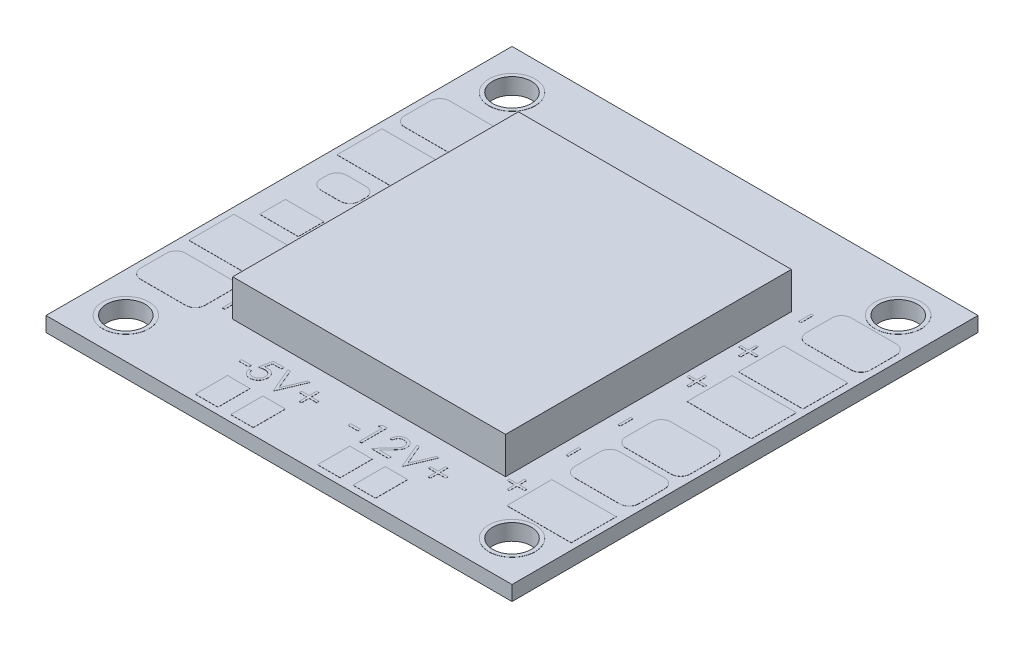
from build123d import *

# Parameters (mm, degrees)
SKETCH1_W                = 36.2
SKETCH1_H                = 36.2
SKETCH1_R                = 1.5
BOSS_EXTRUDE1_DEPTH      = 1.15
BOSS_EXTRUDE2_DEPTH      = 0.1
BOSS_EXTRUDE2_DEPTH_BACK = 1.25
SKETCH2_R                = 1.8
SKETCH2_R_2              = 1.5
SKETCH3_W                = 5
SKETCH3_H                = 3.5
SKETCH3_W_2              = 3
SKETCH3_H_2              = 2
BOSS_EXTRUDE3_DEPTH      = 0.1
FILLET1_R                = 0.75
SKETCH4_W                = 5
SKETCH4_H                = 3.5
BOSS_EXTRUDE4_DEPTH      = 0.1
FILLET2_R                = 0.75
SKETCH6_W                = 1.75
SKETCH6_H                = 2.5
SKETCH6_W_2              = 0.769230769
SKETCH6_H_2              = 0.205128205
SKETCH6_H_3              = 0.205128206
BOSS_EXTRUDE5_DEPTH      = 0.1
SKETCH7_W                = 21.2
SKETCH7_H                = 22.2
BOSS_EXTRUDE6_DEPTH      = 2.85
SKETCH8_W                = 0.17948718
SKETCH8_H                = 0.984438029
SKETCH8_W_2              = 0.179487179
SKETCH8_H_2              = 0.984438028
BOSS_EXTRUDE7_DEPTH      = 0.1
MOVE_START               = 1.16
MOVE_FACE1_OUTLINE_R     = 1.8
MOVE_FACE1_OUTLINE_W     = 5
MOVE_FACE1_OUTLINE_H     = 3.5
MOVE_FACE1_OUTLINE_W_2   = 3
MOVE_FACE1_OUTLINE_H_2   = 2
MOVE_FACE1_OUTLINE_W_3   = 1.75
MOVE_FACE1_OUTLINE_H_3   = 2.5
MOVE_FACE1_OUTLINE_W_4   = 0.769230769
MOVE_FACE1_OUTLINE_H_4   = 0.205128205
MOVE_FACE1_OUTLINE_H_5   = 0.205128206
MOVE_FACE1_OUTLINE_W_5   = 0.179487179
MOVE_FACE1_OUTLINE_H_6   = 0.984438028
MOVE_FACE1_OUTLINE_W_6   = 0.17948718
MOVE_FACE1_OUTLINE_H_7   = 0.984438029
MOVE_FACE1_DEPTH         = 0.09


# Read off the part's stored shape, not the designer's step: Move Face1
with BuildPart() as part:
    # Sketch1 → Boss-Extrude1 (new body)
    with BuildSketch(Plane(origin=(0, 0, 0), x_dir=(1, 0, 0), z_dir=(0, 1, 0))):
        with Locations((18.1, 18.1)):
            Rectangle(SKETCH1_W, SKETCH1_H)
        with Locations(Location((33.1, 33.1, 0), (0, 0, 270))):
            Circle(SKETCH1_R, mode=Mode.SUBTRACT)
        with Locations(Location((33.1, 3.1, 0), (0, 0, 270))):
            Circle(SKETCH1_R, mode=Mode.SUBTRACT)
        with Locations(Location((3.1, 3.1, 0), (0, 0, 270))):
            Circle(SKETCH1_R, mode=Mode.SUBTRACT)
        with Locations(Location((3.1, 33.1, 0), (0, 0, 270))):
            Circle(SKETCH1_R, mode=Mode.SUBTRACT)
    extrude(amount=BOSS_EXTRUDE1_DEPTH)

    # Sketch2 → Boss-Extrude2 (add, two sides: drawn at the far end of the back side and taken through both)
    # profile 1 of 4: a face of its own
    with BuildSketch(Plane(origin=(0, 1.15, 0), x_dir=(1, 0, 0), z_dir=(0, 1, 0)).offset(-BOSS_EXTRUDE2_DEPTH_BACK)):
        with Locations(Location((3.1, 33.1, 0), (0, 0, 270))):
            Circle(SKETCH2_R)
        with Locations(Location((3.1, 33.1, 0), (0, 0, 270))):
            Circle(SKETCH2_R_2, mode=Mode.SUBTRACT)
    # profile 2 of 4: a face of its own
    with BuildSketch(Plane(origin=(0, 1.15, 0), x_dir=(1, 0, 0), z_dir=(0, 1, 0)).offset(-BOSS_EXTRUDE2_DEPTH_BACK)):
        with Locations(Location((33.1, 33.1, 0), (0, 0, 270))):
            Circle(SKETCH2_R)
        with Locations(Location((33.1, 33.1, 0), (0, 0, 270))):
            Circle(SKETCH2_R_2, mode=Mode.SUBTRACT)
    # profile 3 of 4: a face of its own
    with BuildSketch(Plane(origin=(0, 1.15, 0), x_dir=(1, 0, 0), z_dir=(0, 1, 0)).offset(-BOSS_EXTRUDE2_DEPTH_BACK)):
        with Locations(Location((33.1, 3.1, 0), (0, 0, 270))):
            Circle(SKETCH2_R)
        with Locations(Location((33.1, 3.1, 0), (0, 0, 270))):
            Circle(SKETCH2_R_2, mode=Mode.SUBTRACT)
    # profile 4 of 4: a face of its own
    with BuildSketch(Plane(origin=(0, 1.15, 0), x_dir=(1, 0, 0), z_dir=(0, 1, 0)).offset(-BOSS_EXTRUDE2_DEPTH_BACK)):
        with Locations(Location((3.1, 3.1, 0), (0, 0, 270))):
            Circle(SKETCH2_R)
        with Locations(Location((3.1, 3.1, 0), (0, 0, 270))):
            Circle(SKETCH2_R_2, mode=Mode.SUBTRACT)
    extrude(amount=BOSS_EXTRUDE2_DEPTH + BOSS_EXTRUDE2_DEPTH_BACK)

    # Sketch3 → Boss-Extrude3 (add)
    with BuildSketch(Plane(origin=(0, 1.15, 0), x_dir=(1, 0, 0), z_dir=(0, 1, 0))):
        with Locations((3, 12.35)):
            Rectangle(SKETCH3_W, SKETCH3_H)
        with Locations((3, 7.85)):
            Rectangle(SKETCH3_W, SKETCH3_H)
        with Locations((3, 16.1)):
            Rectangle(SKETCH3_W_2, SKETCH3_H_2)
        with Locations((3, 20.1)):
            Rectangle(SKETCH3_W_2, SKETCH3_H_2)
        with Locations((3, 23.85)):
            Rectangle(SKETCH3_W, SKETCH3_H)
        with Locations((3, 28.35)):
            Rectangle(SKETCH3_W, SKETCH3_H)
    extrude(amount=BOSS_EXTRUDE3_DEPTH)

    # Fillet1
    fillet1_edges = [part.edges().sort_by_distance(p)[0] for p in [
        (4.5, 1.2, -19.1),
        (4.5, 1.2, -21.1),
        (1.5, 1.2, -21.1),
        (1.5, 1.2, -19.1),
        (0.5, 1.2, -30.1),
        (0.5, 1.2, -26.6),
        (5.5, 1.2, -26.6),
        (5.5, 1.2, -30.1),
        (5.5, 1.2, -9.6),
        (0.5, 1.2, -9.6),
        (0.5, 1.2, -6.1),
        (5.5, 1.2, -6.1),
    ]]
    fillet(fillet1_edges, radius=FILLET1_R)

    # Sketch4 → Boss-Extrude4 (add)
    with BuildSketch(Plane(origin=(0, 1.15, 0), x_dir=(1, 0, 0), z_dir=(0, 1, 0))):
        with Locations((33.2, 6.85)):
            Rectangle(SKETCH4_W, SKETCH4_H)
        with Locations((33.2, 11.35)):
            Rectangle(SKETCH4_W, SKETCH4_H)
        with Locations((33.2, 15.35)):
            Rectangle(SKETCH4_W, SKETCH4_H)
        with Locations((33.2, 20.85)):
            Rectangle(SKETCH4_W, SKETCH4_H)
        with Locations((33.2, 24.85)):
            Rectangle(SKETCH4_W, SKETCH4_H)
        with Locations((33.2, 29.35)):
            Rectangle(SKETCH4_W, SKETCH4_H)
    extrude(amount=BOSS_EXTRUDE4_DEPTH)

    # Fillet2
    fillet2_edges = [part.edges().sort_by_distance(p)[0] for p in [
        (30.7, 1.2, -13.1),
        (30.7, 1.2, -9.6),
        (35.7, 1.2, -9.6),
        (35.7, 1.2, -13.1),
        (35.7, 1.2, -17.1),
        (30.7, 1.2, -17.1),
        (30.7, 1.2, -13.6),
        (35.7, 1.2, -13.6),
        (35.7, 1.2, -31.1),
        (30.7, 1.2, -31.1),
        (30.7, 1.2, -27.6),
        (35.7, 1.2, -27.6),
    ]]
    fillet(fillet2_edges, radius=FILLET2_R)

    # Sketch6 → Boss-Extrude5 (add)
    with BuildSketch(Plane(origin=(0, 1.15, 0), x_dir=(1, 0, 0), z_dir=(0, 1, 0))):
        with Locations((14.725, 1.75)):
            Rectangle(SKETCH6_W, SKETCH6_H)
        with Locations((11.975, 1.75)):
            Rectangle(SKETCH6_W, SKETCH6_H)
        with Locations((21.475, 1.75)):
            Rectangle(SKETCH6_W, SKETCH6_H)
        with Locations((24.225, 1.75)):
            Rectangle(SKETCH6_W, SKETCH6_H)
        Polygon((25.116591699, 4.749584686), (25.706335289, 4.749584686), (25.706335289, 5.339328276), (25.885822468, 5.339328276), (25.885822468, 4.749584686), (26.475566058, 4.749584686), (26.475566058, 4.570097507), (25.885822468, 4.570097507), (25.885822468, 3.980353917), (25.706335289, 3.980353917), (25.706335289, 4.570097507), (25.116591699, 4.570097507), align=None)
        Polygon((23.988386571, 3.672661609), (23.142232725, 5.672661609), (23.334540417, 5.672661609), (24.001207083, 4.096539814), (24.66787375, 5.672661609), (24.860181442, 5.672661609), (24.014027596, 3.672661609), align=None)
        with BuildLine():
            add(Edge.make_bspline(
                [(22.298082083, 5.518815455), (22.267403513, 5.518541426), (22.221911666, 5.51547508), (22.163608709, 5.502300234), (22.122556889, 5.489066435), (22.083402658, 5.472230352), (22.046337537, 5.451264342), (22.011444449, 5.426245012), (21.97865785, 5.397879034), (21.94844993, 5.366297527), (21.921908598, 5.331091861), (21.898718729, 5.292904679), (21.878481032, 5.251839555), (21.862064308, 5.207521802), (21.844846661, 5.142825568), (21.837018135, 5.092084197), (21.834540417, 5.057276994)],
                knots=[0, 0, 0, 0, 0.126546911, 0.186887153, 0.245877536, 0.304040885, 0.362191218, 0.420975933, 0.480660283, 0.540600275, 0.600689098, 0.66193579, 0.724442506, 0.789038394, 0.856313757, 1, 1, 1, 1], degree=3))
            Line((21.834540417, 5.057276994), (21.655053237, 5.057276994))
            add(Edge.make_bspline(
                [(21.655053237, 5.057276994), (21.656188918, 5.104079344), (21.663698549, 5.172826753), (21.684691693, 5.261213654), (21.706436334, 5.322854291), (21.733474214, 5.381504858), (21.765889848, 5.436933488), (21.804286744, 5.488928432), (21.847833339, 5.537007805), (21.895129729, 5.581114876), (21.946161704, 5.619203988), (21.999787372, 5.651384058), (22.055844407, 5.678293014), (22.114963839, 5.698466833), (22.19833106, 5.71883383), (22.263434243, 5.724027812), (22.307296827, 5.723943661)],
                knots=[0, 0, 0, 0, 0.135103289, 0.198978674, 0.2619043, 0.323494969, 0.385195378, 0.446969239, 0.509764777, 0.572250569, 0.633405176, 0.693251163, 0.752583163, 0.812579266, 0.873275085, 1, 1, 1, 1], degree=3))
            add(Edge.make_bspline(
                [(22.307296827, 5.723943661), (22.350373881, 5.724014796), (22.413808172, 5.718698363), (22.495085012, 5.700173097), (22.551820594, 5.681155865), (22.60496699, 5.6555595), (22.654922997, 5.624819447), (22.702283461, 5.589264879), (22.744915927, 5.547405659), (22.784063327, 5.502718561), (22.817836311, 5.455011169), (22.846757152, 5.405737383), (22.870867935, 5.354520927), (22.888601065, 5.300881616), (22.906832764, 5.226343072), (22.910960033, 5.168246206), (22.911463494, 5.129392379)],
                knots=[0, 0, 0, 0, 0.136516798, 0.200788824, 0.263829673, 0.325735023, 0.387290692, 0.449509219, 0.51296782, 0.576275215, 0.6375801, 0.697902606, 0.757172088, 0.816598528, 0.876653171, 1, 1, 1, 1], degree=3))
            add(Edge.make_bspline(
                [(22.911463494, 5.129392379), (22.91169315, 5.074154969), (22.901000515, 4.991679583), (22.866506285, 4.886537579), (22.835692252, 4.823258841), (22.804559095, 4.772268314), (22.776510539, 4.730286189), (22.743673072, 4.685083057), (22.705571123, 4.636810337), (22.662992679, 4.585089624), (22.597242096, 4.508676856), (22.54373959, 4.451459909), (22.506816058, 4.411844302)],
                knots=[0, 0, 0, 0, 0.195672309, 0.292422427, 0.391342544, 0.444462441, 0.504228775, 0.570352338, 0.642545753, 0.722287505, 0.807921123, 1, 1, 1, 1], degree=3))
            Line((22.506816058, 4.411844302), (22.006415417, 3.877789814))
            Line((22.006415417, 3.877789814), (22.937104519, 3.877789814))
            Line((22.937104519, 3.877789814), (22.937104519, 3.672661609))
            Line((22.937104519, 3.672661609), (21.57813016, 3.672661609))
            Line((21.57813016, 3.672661609), (22.353771186, 4.500385968))
            add(Edge.make_bspline(
                [(22.353771186, 4.500385968), (22.390136497, 4.538157854), (22.441995618, 4.592932834), (22.506311591, 4.66453281), (22.547465803, 4.711723733), (22.58279878, 4.755513516), (22.614154849, 4.794481855), (22.639276691, 4.830341531), (22.666547904, 4.871907692), (22.692921286, 4.922656933), (22.723264396, 5.005091021), (22.732009138, 5.070254844), (22.731976314, 5.113366737)],
                knots=[0, 0, 0, 0, 0.212829202, 0.30610131, 0.390647321, 0.466924469, 0.534481039, 0.593586941, 0.644557005, 0.736200453, 0.825024026, 1, 1, 1, 1], degree=3))
            add(Edge.make_bspline(
                [(22.731976314, 5.113366737), (22.732119273, 5.14027045), (22.727976173, 5.180096684), (22.715016061, 5.231376665), (22.701350207, 5.268136057), (22.683284537, 5.303247808), (22.661301018, 5.336754954), (22.635934914, 5.36914864), (22.606591431, 5.399521973), (22.574356251, 5.427339736), (22.540302398, 5.45198232), (22.504273777, 5.472575188), (22.466422233, 5.489460593), (22.426853568, 5.502690768), (22.370853515, 5.515180382), (22.3274636, 5.518703737), (22.298082083, 5.518815455)],
                knots=[0, 0, 0, 0, 0.122121906, 0.180988497, 0.239933216, 0.299905831, 0.359988847, 0.421775742, 0.486575826, 0.551534805, 0.615017543, 0.677258617, 0.739729962, 0.803050103, 0.866495132, 1, 1, 1, 1], degree=3))
        make_face()
        Polygon((20.34736093, 5.467533404), (20.46474875, 5.672661609), (20.834540417, 5.672661609), (20.834540417, 3.672661609), (20.655053237, 3.672661609), (20.655053237, 5.467533404), align=None)
        with Locations((19.501207083, 4.441892379)):
            Rectangle(SKETCH6_W_2, SKETCH6_H_2)
        with BuildLine():
            add(Edge.make_bspline(
                [(12.16370382, 4.843225023), (12.13168704, 4.843166845), (12.082409474, 4.839640055), (12.015499602, 4.829014911), (11.96160495, 4.817840087), (11.905252177, 4.803185163), (11.824797339, 4.779154032), (11.764108106, 4.756731126), (11.722998691, 4.740660921)],
                knots=[0, 0, 0, 0, 0.211023342, 0.325099662, 0.446502097, 0.573787718, 0.70890071, 1, 1, 1, 1], degree=3))
            Line((11.722998691, 4.740660921), (11.928126897, 5.740660921))
            Line((11.928126897, 5.740660921), (12.748639717, 5.740660921))
            Line((12.748639717, 5.740660921), (12.748639717, 5.535532716))
            Line((12.748639717, 5.535532716), (12.068351256, 5.535532716))
            Line((12.068351256, 5.535532716), (11.96057882, 5.009491049))
            add(Edge.make_bspline(
                [(11.96057882, 5.009491049), (12.001470777, 5.021085013), (12.079033852, 5.041068879), (12.158849901, 5.048213881), (12.196155743, 5.048353228)],
                knots=[0, 0, 0, 0, 0.53290146, 1, 1, 1, 1], degree=3))
            add(Edge.make_bspline(
                [(12.196155743, 5.048353228), (12.240054787, 5.04857831), (12.30489077, 5.042988399), (12.387986802, 5.023409257), (12.446273599, 5.003362686), (12.501622556, 4.977694125), (12.553524003, 4.945638583), (12.602757093, 4.908190537), (12.648438604, 4.865136363), (12.689880954, 4.817752549), (12.726319075, 4.766805207), (12.757267589, 4.71278938), (12.782165221, 4.655189102), (12.802019765, 4.594640746), (12.820098589, 4.507570467), (12.825768408, 4.44000911), (12.825562794, 4.394106434)],
                knots=[0, 0, 0, 0, 0.129394274, 0.190894061, 0.251281069, 0.310814964, 0.370370987, 0.430768263, 0.492881251, 0.555103948, 0.616067051, 0.677256033, 0.738259805, 0.800762134, 0.864777582, 1, 1, 1, 1], degree=3))
            add(Edge.make_bspline(
                [(12.825562794, 4.394106434), (12.825015114, 4.361760177), (12.823137624, 4.313467518), (12.813193468, 4.250284098), (12.803273229, 4.204231914), (12.790390744, 4.159277825), (12.774797292, 4.115294138), (12.755713768, 4.072554351), (12.734781575, 4.030654128), (12.711212154, 3.990540695), (12.685053008, 3.953026988), (12.657415584, 3.917550256), (12.62767765, 3.88449098), (12.595562795, 3.854066399), (12.561459957, 3.826095951), (12.525641261, 3.800106624), (12.487552551, 3.77715335), (12.448042559, 3.756031737), (12.406540727, 3.738703716), (12.363991731, 3.723213061), (12.319783326, 3.710860659), (12.274015065, 3.701200672), (12.210068062, 3.692252789), (12.161137296, 3.688861335), (12.128046768, 3.68937887)],
                knots=[0, 0, 0, 0, 0.087434124, 0.130118399, 0.172553695, 0.214554756, 0.256298092, 0.298438225, 0.340849003, 0.382715189, 0.423924045, 0.464246243, 0.504073671, 0.543861906, 0.583566725, 0.623094319, 0.663229061, 0.703551259, 0.743937895, 0.784541255, 0.825750111, 0.867757363, 0.910745164, 1, 1, 1, 1], degree=3))
            add(Edge.make_bspline(
                [(12.128046768, 3.68937887), (12.088806192, 3.688926707), (12.030980678, 3.69446311), (11.956207185, 3.710330321), (11.903560754, 3.727813188), (11.853063063, 3.749755011), (11.80539289, 3.777476865), (11.759332465, 3.808893952), (11.716754134, 3.845968312), (11.677236437, 3.886491603), (11.641860989, 3.930467349), (11.610357206, 3.977170039), (11.583222841, 4.026825562), (11.560097102, 4.079306859), (11.535415586, 4.154387222), (11.52324172, 4.213281975), (11.517870486, 4.253481434)],
                knots=[0, 0, 0, 0, 0.128708372, 0.190236142, 0.250724402, 0.310637179, 0.370766408, 0.431614744, 0.493522974, 0.555883455, 0.617342367, 0.678668039, 0.74071136, 0.802985363, 0.86680258, 1, 1, 1, 1], degree=3))
            Line((11.517870486, 4.253481434), (11.697357666, 4.253481434))
            add(Edge.make_bspline(
                [(11.697357666, 4.253481434), (11.705043092, 4.216729093), (11.720114672, 4.163799515), (11.751685397, 4.100352172), (11.778760221, 4.059453657), (11.811077998, 4.023791919), (11.847950983, 3.992010098), (11.889292909, 3.963340722), (11.935231421, 3.939433767), (11.983697581, 3.919082847), (12.051368072, 3.900819801), (12.103489987, 3.893996129), (12.138463435, 3.894507075)],
                knots=[0, 0, 0, 0, 0.181994156, 0.264376949, 0.342179862, 0.418617611, 0.496509075, 0.577369092, 0.661510592, 0.746732551, 0.831257984, 1, 1, 1, 1], degree=3))
            add(Edge.make_bspline(
                [(12.138463435, 3.894507075), (12.172180732, 3.894538756), (12.222185959, 3.899111511), (12.286789644, 3.91396868), (12.332496894, 3.930333878), (12.376817723, 3.950249823), (12.418631321, 3.975800017), (12.459147243, 4.005206093), (12.497106196, 4.038895499), (12.531871525, 4.076021061), (12.562589565, 4.115722437), (12.588175433, 4.158074865), (12.609741265, 4.202345451), (12.626101449, 4.249018108), (12.64199027, 4.315198608), (12.645816294, 4.366863813), (12.646075615, 4.401718613)],
                knots=[0, 0, 0, 0, 0.12642469, 0.187680284, 0.248216424, 0.30830506, 0.369660991, 0.431698552, 0.495946892, 0.559758024, 0.622295408, 0.683910635, 0.745092408, 0.806740225, 0.869086618, 1, 1, 1, 1], degree=3))
            add(Edge.make_bspline(
                [(12.646075615, 4.401718613), (12.645930038, 4.433073736), (12.642755831, 4.479482155), (12.62846982, 4.538577762), (12.613952884, 4.579785015), (12.595504556, 4.618770071), (12.572964578, 4.655571758), (12.545905284, 4.689705391), (12.51499569, 4.721186857), (12.48113394, 4.750241029), (12.443737506, 4.775009241), (12.403589028, 4.795845152), (12.36117191, 4.813829233), (12.315478478, 4.826734721), (12.249838982, 4.840024204), (12.198500111, 4.842958086), (12.16370382, 4.843225023)],
                knots=[0, 0, 0, 0, 0.127916032, 0.188360206, 0.247216077, 0.305630129, 0.36376984, 0.422660914, 0.482687294, 0.543300221, 0.604117955, 0.664964891, 0.727413494, 0.791467625, 0.858055443, 1, 1, 1, 1], degree=3))
        make_face()
        Polygon((15.030690999, 4.817583998), (15.620434589, 4.817583998), (15.620434589, 5.407327587), (15.799921768, 5.407327587), (15.799921768, 4.817583998), (16.389665358, 4.817583998), (16.389665358, 4.638096818), (15.799921768, 4.638096818), (15.799921768, 4.048353228), (15.620434589, 4.048353228), (15.620434589, 4.638096818), (15.030690999, 4.638096818), align=None)
        with Locations((10.953767923, 4.50989169)):
            Rectangle(SKETCH6_W_2, SKETCH6_H_3)
        Polygon((13.902485871, 3.740660921), (13.056332025, 5.740660921), (13.248639717, 5.740660921), (13.915306384, 4.164539126), (14.58197305, 5.740660921), (14.774280743, 5.740660921), (13.928126897, 3.740660921), align=None)
    extrude(amount=BOSS_EXTRUDE5_DEPTH)

    # Sketch7 → Boss-Extrude6 (add)
    with BuildSketch(Plane(origin=(0, 1.15, 0), x_dir=(1, 0, 0), z_dir=(0, 1, 0))):
        with Locations((18.1, 18.1)):
            Rectangle(SKETCH7_W, SKETCH7_H)
    extrude(amount=BOSS_EXTRUDE6_DEPTH)

    # Sketch8 → Boss-Extrude7 (add)
    with BuildSketch(Plane(origin=(0, 1.15, 0), x_dir=(1, 0, 0), z_dir=(0, 1, 0))):
        Polygon((6.413850207, 23.91623645), (6.413850207, 24.50598004), (6.593337386, 24.50598004), (6.593337386, 23.91623645), (7.183080976, 23.91623645), (7.183080976, 23.736749271), (6.593337386, 23.736749271), (6.593337386, 23.147005681), (6.413850207, 23.147005681), (6.413850207, 23.736749271), (5.824106617, 23.736749271), (5.824106617, 23.91623645), align=None)
        Polygon((6.408009777, 12.435432042), (6.408009777, 13.025175632), (6.587496956, 13.025175632), (6.587496956, 12.435432042), (7.177240546, 12.435432042), (7.177240546, 12.255944862), (6.587496956, 12.255944862), (6.587496956, 11.666201273), (6.408009777, 11.666201273), (6.408009777, 12.255944862), (5.818266187, 12.255944862), (5.818266187, 12.435432042), align=None)
        Polygon((6.38587471, 16.150918099), (6.38587471, 16.740661689), (6.56536189, 16.740661689), (6.56536189, 16.150918099), (7.155105479, 16.150918099), (7.155105479, 15.97143092), (6.56536189, 15.97143092), (6.56536189, 15.38168733), (6.38587471, 15.38168733), (6.38587471, 15.97143092), (5.79613112, 15.97143092), (5.79613112, 16.150918099), align=None)
        Polygon((29.610733191, 6.980624635), (29.610733191, 7.570368225), (29.790220371, 7.570368225), (29.790220371, 6.980624635), (30.379963961, 6.980624635), (30.379963961, 6.801137456), (29.790220371, 6.801137456), (29.790220371, 6.211393866), (29.610733191, 6.211393866), (29.610733191, 6.801137456), (29.020989602, 6.801137456), (29.020989602, 6.980624635), align=None)
        Polygon((29.613806009, 20.937785377), (29.613806009, 21.527528967), (29.793293189, 21.527528967), (29.793293189, 20.937785377), (30.383036779, 20.937785377), (30.383036779, 20.758298198), (29.793293189, 20.758298198), (29.793293189, 20.168554608), (29.613806009, 20.168554608), (29.613806009, 20.758298198), (29.02406242, 20.758298198), (29.02406242, 20.937785377), align=None)
        Polygon((29.603760052, 24.96079073), (29.603760052, 25.55053432), (29.783247232, 25.55053432), (29.783247232, 24.96079073), (30.372990822, 24.96079073), (30.372990822, 24.781303551), (29.783247232, 24.781303551), (29.783247232, 24.191559961), (29.603760052, 24.191559961), (29.603760052, 24.781303551), (29.014016463, 24.781303551), (29.014016463, 24.96079073), align=None)
        with Locations((6.436664338, 20.101629096)):
            Rectangle(SKETCH8_W, SKETCH8_H)
        with Locations((6.503593797, 28.305588638)):
            Rectangle(SKETCH8_W_2, SKETCH8_H_2)
        with Locations((6.438743943, 7.839661137)):
            Rectangle(SKETCH8_W, SKETCH8_H)
        with Locations((29.668077234, 15.351769276)):
            Rectangle(SKETCH8_W_2, SKETCH8_H)
        with Locations((29.670053735, 11.296604652)):
            Rectangle(SKETCH8_W_2, SKETCH8_H)
        with Locations((29.725419986, 29.319055313)):
            Rectangle(SKETCH8_W, SKETCH8_H)
    extrude(amount=BOSS_EXTRUDE7_DEPTH)

    # Move Face1 outline → Move Face1 (cut)
    with BuildSketch(Plane(origin=(0, 0, 0), x_dir=(1, 0, 0), z_dir=(0, 1, 0)).offset(MOVE_START)):
        with BuildLine():
            add(Edge.make_bspline(
                [(22.298082083, 5.518815455), (22.267403513, 5.518541426), (22.221911666, 5.51547508), (22.163608709, 5.502300234), (22.122556889, 5.489066435), (22.083402658, 5.472230352), (22.046337537, 5.451264342), (22.011444449, 5.426245012), (21.97865785, 5.397879034), (21.94844993, 5.366297527), (21.921908598, 5.331091861), (21.898718729, 5.292904679), (21.878481032, 5.251839555), (21.862064308, 5.207521802), (21.844846661, 5.142825568), (21.837018135, 5.092084197), (21.834540417, 5.057276994)],
                knots=[0, 0, 0, 0, 0.126546911, 0.186887153, 0.245877536, 0.304040885, 0.362191218, 0.420975933, 0.480660283, 0.540600275, 0.600689098, 0.66193579, 0.724442506, 0.789038394, 0.856313757, 1, 1, 1, 1], degree=3))
            add(Edge.make_bspline(
                [(22.731976314, 5.113366737), (22.732119273, 5.14027045), (22.727976173, 5.180096684), (22.715016061, 5.231376665), (22.701350207, 5.268136057), (22.683284537, 5.303247808), (22.661301018, 5.336754954), (22.635934914, 5.36914864), (22.606591431, 5.399521973), (22.574356251, 5.427339736), (22.540302398, 5.45198232), (22.504273777, 5.472575188), (22.466422233, 5.489460593), (22.426853568, 5.502690768), (22.370853515, 5.515180382), (22.3274636, 5.518703737), (22.298082083, 5.518815455)],
                knots=[0, 0, 0, 0, 0.122121906, 0.180988497, 0.239933216, 0.299905831, 0.359988847, 0.421775742, 0.486575826, 0.551534805, 0.615017543, 0.677258617, 0.739729962, 0.803050103, 0.866495132, 1, 1, 1, 1], degree=3))
            add(Edge.make_bspline(
                [(22.353771186, 4.500385968), (22.390136497, 4.538157854), (22.441995618, 4.592932834), (22.506311591, 4.66453281), (22.547465803, 4.711723733), (22.58279878, 4.755513516), (22.614154849, 4.794481855), (22.639276691, 4.830341531), (22.666547904, 4.871907692), (22.692921286, 4.922656933), (22.723264396, 5.005091021), (22.732009138, 5.070254844), (22.731976314, 5.113366737)],
                knots=[0, 0, 0, 0, 0.212829202, 0.30610131, 0.390647321, 0.466924469, 0.534481039, 0.593586941, 0.644557005, 0.736200453, 0.825024026, 1, 1, 1, 1], degree=3))
            Line((22.353771186, 4.500385968), (21.57813016, 3.672661609))
            Line((21.57813016, 3.672661609), (22.937104519, 3.672661609))
            Line((22.937104519, 3.672661609), (22.937104519, 3.877789814))
            Line((22.937104519, 3.877789814), (22.006415417, 3.877789814))
            Line((22.006415417, 3.877789814), (22.506816058, 4.411844302))
            add(Edge.make_bspline(
                [(22.911463494, 5.129392379), (22.91169315, 5.074154969), (22.901000515, 4.991679583), (22.866506285, 4.886537579), (22.835692252, 4.823258841), (22.804559095, 4.772268314), (22.776510539, 4.730286189), (22.743673072, 4.685083057), (22.705571123, 4.636810337), (22.662992679, 4.585089624), (22.597242096, 4.508676856), (22.54373959, 4.451459909), (22.506816058, 4.411844302)],
                knots=[0, 0, 0, 0, 0.195672309, 0.292422427, 0.391342544, 0.444462441, 0.504228775, 0.570352338, 0.642545753, 0.722287505, 0.807921123, 1, 1, 1, 1], degree=3))
            add(Edge.make_bspline(
                [(22.307296827, 5.723943661), (22.350373881, 5.724014796), (22.413808172, 5.718698363), (22.495085012, 5.700173097), (22.551820594, 5.681155865), (22.60496699, 5.6555595), (22.654922997, 5.624819447), (22.702283461, 5.589264879), (22.744915927, 5.547405659), (22.784063327, 5.502718561), (22.817836311, 5.455011169), (22.846757152, 5.405737383), (22.870867935, 5.354520927), (22.888601065, 5.300881616), (22.906832764, 5.226343072), (22.910960033, 5.168246206), (22.911463494, 5.129392379)],
                knots=[0, 0, 0, 0, 0.136516798, 0.200788824, 0.263829673, 0.325735023, 0.387290692, 0.449509219, 0.51296782, 0.576275215, 0.6375801, 0.697902606, 0.757172088, 0.816598528, 0.876653171, 1, 1, 1, 1], degree=3))
            add(Edge.make_bspline(
                [(21.655053237, 5.057276994), (21.656188918, 5.104079344), (21.663698549, 5.172826753), (21.684691693, 5.261213654), (21.706436334, 5.322854291), (21.733474214, 5.381504858), (21.765889848, 5.436933488), (21.804286744, 5.488928432), (21.847833339, 5.537007805), (21.895129729, 5.581114876), (21.946161704, 5.619203988), (21.999787372, 5.651384058), (22.055844407, 5.678293014), (22.114963839, 5.698466833), (22.19833106, 5.71883383), (22.263434243, 5.724027812), (22.307296827, 5.723943661)],
                knots=[0, 0, 0, 0, 0.135103289, 0.198978674, 0.2619043, 0.323494969, 0.385195378, 0.446969239, 0.509764777, 0.572250569, 0.633405176, 0.693251163, 0.752583163, 0.812579266, 0.873275085, 1, 1, 1, 1], degree=3))
            Line((21.655053237, 5.057276994), (21.834540417, 5.057276994))
        make_face()
        with BuildLine():
            add(Edge.make_bspline(
                [(12.16370382, 4.843225023), (12.13168704, 4.843166845), (12.082409474, 4.839640055), (12.015499602, 4.829014911), (11.96160495, 4.817840087), (11.905252177, 4.803185163), (11.824797339, 4.779154032), (11.764108106, 4.756731126), (11.722998691, 4.740660921)],
                knots=[0, 0, 0, 0, 0.211023342, 0.325099662, 0.446502097, 0.573787718, 0.70890071, 1, 1, 1, 1], degree=3))
            add(Edge.make_bspline(
                [(12.646075615, 4.401718613), (12.645930038, 4.433073736), (12.642755831, 4.479482155), (12.62846982, 4.538577762), (12.613952884, 4.579785015), (12.595504556, 4.618770071), (12.572964578, 4.655571758), (12.545905284, 4.689705391), (12.51499569, 4.721186857), (12.48113394, 4.750241029), (12.443737506, 4.775009241), (12.403589028, 4.795845152), (12.36117191, 4.813829233), (12.315478478, 4.826734721), (12.249838982, 4.840024204), (12.198500111, 4.842958086), (12.16370382, 4.843225023)],
                knots=[0, 0, 0, 0, 0.127916032, 0.188360206, 0.247216077, 0.305630129, 0.36376984, 0.422660914, 0.482687294, 0.543300221, 0.604117955, 0.664964891, 0.727413494, 0.791467625, 0.858055443, 1, 1, 1, 1], degree=3))
            add(Edge.make_bspline(
                [(12.138463435, 3.894507075), (12.172180732, 3.894538756), (12.222185959, 3.899111511), (12.286789644, 3.91396868), (12.332496894, 3.930333878), (12.376817723, 3.950249823), (12.418631321, 3.975800017), (12.459147243, 4.005206093), (12.497106196, 4.038895499), (12.531871525, 4.076021061), (12.562589565, 4.115722437), (12.588175433, 4.158074865), (12.609741265, 4.202345451), (12.626101449, 4.249018108), (12.64199027, 4.315198608), (12.645816294, 4.366863813), (12.646075615, 4.401718613)],
                knots=[0, 0, 0, 0, 0.12642469, 0.187680284, 0.248216424, 0.30830506, 0.369660991, 0.431698552, 0.495946892, 0.559758024, 0.622295408, 0.683910635, 0.745092408, 0.806740225, 0.869086618, 1, 1, 1, 1], degree=3))
            add(Edge.make_bspline(
                [(11.697357666, 4.253481434), (11.705043092, 4.216729093), (11.720114672, 4.163799515), (11.751685397, 4.100352172), (11.778760221, 4.059453657), (11.811077998, 4.023791919), (11.847950983, 3.992010098), (11.889292909, 3.963340722), (11.935231421, 3.939433767), (11.983697581, 3.919082847), (12.051368072, 3.900819801), (12.103489987, 3.893996129), (12.138463435, 3.894507075)],
                knots=[0, 0, 0, 0, 0.181994156, 0.264376949, 0.342179862, 0.418617611, 0.496509075, 0.577369092, 0.661510592, 0.746732551, 0.831257984, 1, 1, 1, 1], degree=3))
            Line((11.697357666, 4.253481434), (11.517870486, 4.253481434))
            add(Edge.make_bspline(
                [(12.128046768, 3.68937887), (12.088806192, 3.688926707), (12.030980678, 3.69446311), (11.956207185, 3.710330321), (11.903560754, 3.727813188), (11.853063063, 3.749755011), (11.80539289, 3.777476865), (11.759332465, 3.808893952), (11.716754134, 3.845968312), (11.677236437, 3.886491603), (11.641860989, 3.930467349), (11.610357206, 3.977170039), (11.583222841, 4.026825562), (11.560097102, 4.079306859), (11.535415586, 4.154387222), (11.52324172, 4.213281975), (11.517870486, 4.253481434)],
                knots=[0, 0, 0, 0, 0.128708372, 0.190236142, 0.250724402, 0.310637179, 0.370766408, 0.431614744, 0.493522974, 0.555883455, 0.617342367, 0.678668039, 0.74071136, 0.802985363, 0.86680258, 1, 1, 1, 1], degree=3))
            add(Edge.make_bspline(
                [(12.825562794, 4.394106434), (12.825015114, 4.361760177), (12.823137624, 4.313467518), (12.813193468, 4.250284098), (12.803273229, 4.204231914), (12.790390744, 4.159277825), (12.774797292, 4.115294138), (12.755713768, 4.072554351), (12.734781575, 4.030654128), (12.711212154, 3.990540695), (12.685053008, 3.953026988), (12.657415584, 3.917550256), (12.62767765, 3.88449098), (12.595562795, 3.854066399), (12.561459957, 3.826095951), (12.525641261, 3.800106624), (12.487552551, 3.77715335), (12.448042559, 3.756031737), (12.406540727, 3.738703716), (12.363991731, 3.723213061), (12.319783326, 3.710860659), (12.274015065, 3.701200672), (12.210068062, 3.692252789), (12.161137296, 3.688861335), (12.128046768, 3.68937887)],
                knots=[0, 0, 0, 0, 0.087434124, 0.130118399, 0.172553695, 0.214554756, 0.256298092, 0.298438225, 0.340849003, 0.382715189, 0.423924045, 0.464246243, 0.504073671, 0.543861906, 0.583566725, 0.623094319, 0.663229061, 0.703551259, 0.743937895, 0.784541255, 0.825750111, 0.867757363, 0.910745164, 1, 1, 1, 1], degree=3))
            add(Edge.make_bspline(
                [(12.196155743, 5.048353228), (12.240054787, 5.04857831), (12.30489077, 5.042988399), (12.387986802, 5.023409257), (12.446273599, 5.003362686), (12.501622556, 4.977694125), (12.553524003, 4.945638583), (12.602757093, 4.908190537), (12.648438604, 4.865136363), (12.689880954, 4.817752549), (12.726319075, 4.766805207), (12.757267589, 4.71278938), (12.782165221, 4.655189102), (12.802019765, 4.594640746), (12.820098589, 4.507570467), (12.825768408, 4.44000911), (12.825562794, 4.394106434)],
                knots=[0, 0, 0, 0, 0.129394274, 0.190894061, 0.251281069, 0.310814964, 0.370370987, 0.430768263, 0.492881251, 0.555103948, 0.616067051, 0.677256033, 0.738259805, 0.800762134, 0.864777582, 1, 1, 1, 1], degree=3))
            add(Edge.make_bspline(
                [(11.96057882, 5.009491049), (12.001470777, 5.021085013), (12.079033852, 5.041068879), (12.158849901, 5.048213881), (12.196155743, 5.048353228)],
                knots=[0, 0, 0, 0, 0.53290146, 1, 1, 1, 1], degree=3))
            Line((11.96057882, 5.009491049), (12.068351256, 5.535532716))
            Line((12.068351256, 5.535532716), (12.748639717, 5.535532716))
            Line((12.748639717, 5.535532716), (12.748639717, 5.740660921))
            Line((12.748639717, 5.740660921), (11.928126897, 5.740660921))
            Line((11.928126897, 5.740660921), (11.722998691, 4.740660921))
        make_face()
        with Locations((3.1, 33.1)):
            Circle(MOVE_FACE1_OUTLINE_R)
        with Locations((33.1, 33.1)):
            Circle(MOVE_FACE1_OUTLINE_R)
        with Locations((33.1, 3.1)):
            Circle(MOVE_FACE1_OUTLINE_R)
        with Locations((3.1, 3.1)):
            Circle(MOVE_FACE1_OUTLINE_R)
        with Locations((3, 12.35)):
            Rectangle(MOVE_FACE1_OUTLINE_W, MOVE_FACE1_OUTLINE_H)
        with BuildLine():
            Line((0.5, 8.85), (0.5, 6.85))
            ThreePointArc((0.5, 6.85), (0.719669914, 6.319669914), (1.25, 6.1))
            Line((1.25, 6.1), (4.75, 6.1))
            ThreePointArc((4.75, 6.1), (5.280330086, 6.319669914), (5.5, 6.85))
            Line((5.5, 6.85), (5.5, 8.85))
            ThreePointArc((5.5, 8.85), (5.280330086, 9.380330086), (4.75, 9.6))
            Line((4.75, 9.6), (1.25, 9.6))
            ThreePointArc((1.25, 9.6), (0.719669914, 9.380330086), (0.5, 8.85))
        make_face()
        with Locations((3, 23.85)):
            Rectangle(MOVE_FACE1_OUTLINE_W, MOVE_FACE1_OUTLINE_H)
        with BuildLine():
            Line((0.5, 29.35), (0.5, 27.35))
            ThreePointArc((0.5, 27.35), (0.719669914, 26.819669914), (1.25, 26.6))
            Line((1.25, 26.6), (4.75, 26.6))
            ThreePointArc((4.75, 26.6), (5.280330086, 26.819669914), (5.5, 27.35))
            Line((5.5, 27.35), (5.5, 29.35))
            ThreePointArc((5.5, 29.35), (5.280330086, 29.880330086), (4.75, 30.1))
            Line((4.75, 30.1), (1.25, 30.1))
            ThreePointArc((1.25, 30.1), (0.719669914, 29.880330086), (0.5, 29.35))
        make_face()
        with Locations((3, 16.1)):
            Rectangle(MOVE_FACE1_OUTLINE_W_2, MOVE_FACE1_OUTLINE_H_2)
        with BuildLine():
            ThreePointArc((35.7, 16.35), (35.480330086, 16.880330086), (34.95, 17.1))
            Line((34.95, 17.1), (31.45, 17.1))
            ThreePointArc((31.45, 17.1), (30.919669914, 16.880330086), (30.7, 16.35))
            Line((30.7, 16.35), (30.7, 14.35))
            ThreePointArc((30.7, 14.35), (30.919669914, 13.819669914), (31.45, 13.6))
            Line((31.45, 13.6), (34.95, 13.6))
            ThreePointArc((34.95, 13.6), (35.480330086, 13.819669914), (35.7, 14.35))
            Line((35.7, 14.35), (35.7, 16.35))
        make_face()
        with BuildLine():
            Line((1.5, 20.35), (1.5, 19.85))
            ThreePointArc((1.5, 19.85), (1.719669914, 19.319669914), (2.25, 19.1))
            Line((2.25, 19.1), (3.75, 19.1))
            ThreePointArc((3.75, 19.1), (4.280330086, 19.319669914), (4.5, 19.85))
            Line((4.5, 19.85), (4.5, 20.35))
            ThreePointArc((4.5, 20.35), (4.280330086, 20.880330086), (3.75, 21.1))
            Line((3.75, 21.1), (2.25, 21.1))
            ThreePointArc((2.25, 21.1), (1.719669914, 20.880330086), (1.5, 20.35))
        make_face()
        with Locations((33.2, 20.85)):
            Rectangle(MOVE_FACE1_OUTLINE_W, MOVE_FACE1_OUTLINE_H)
        with Locations((33.2, 6.85)):
            Rectangle(MOVE_FACE1_OUTLINE_W, MOVE_FACE1_OUTLINE_H)
        with BuildLine():
            ThreePointArc((31.45, 13.1), (30.919669914, 12.880330086), (30.7, 12.35))
            Line((30.7, 12.35), (30.7, 10.35))
            ThreePointArc((30.7, 10.35), (30.919669914, 9.819669914), (31.45, 9.6))
            Line((31.45, 9.6), (34.95, 9.6))
            ThreePointArc((34.95, 9.6), (35.480330086, 9.819669914), (35.7, 10.35))
            Line((35.7, 10.35), (35.7, 12.35))
            ThreePointArc((35.7, 12.35), (35.480330086, 12.880330086), (34.95, 13.1))
            Line((34.95, 13.1), (31.45, 13.1))
        make_face()
        with Locations((33.2, 24.85)):
            Rectangle(MOVE_FACE1_OUTLINE_W, MOVE_FACE1_OUTLINE_H)
        with BuildLine():
            ThreePointArc((31.45, 31.1), (30.919669914, 30.880330086), (30.7, 30.35))
            Line((30.7, 30.35), (30.7, 28.35))
            ThreePointArc((30.7, 28.35), (30.919669914, 27.819669914), (31.45, 27.6))
            Line((31.45, 27.6), (34.95, 27.6))
            ThreePointArc((34.95, 27.6), (35.480330086, 27.819669914), (35.7, 28.35))
            Line((35.7, 28.35), (35.7, 30.35))
            ThreePointArc((35.7, 30.35), (35.480330086, 30.880330086), (34.95, 31.1))
            Line((34.95, 31.1), (31.45, 31.1))
        make_face()
        with Locations((14.725, 1.75)):
            Rectangle(MOVE_FACE1_OUTLINE_W_3, MOVE_FACE1_OUTLINE_H_3)
        with Locations((11.975, 1.75)):
            Rectangle(MOVE_FACE1_OUTLINE_W_3, MOVE_FACE1_OUTLINE_H_3)
        with Locations((21.475, 1.75)):
            Rectangle(MOVE_FACE1_OUTLINE_W_3, MOVE_FACE1_OUTLINE_H_3)
        with Locations((24.225, 1.75)):
            Rectangle(MOVE_FACE1_OUTLINE_W_3, MOVE_FACE1_OUTLINE_H_3)
        Polygon((25.706335289, 5.339328276), (25.706335289, 4.749584686), (25.116591699, 4.749584686), (25.116591699, 4.570097507), (25.706335289, 4.570097507), (25.706335289, 3.980353917), (25.885822468, 3.980353917), (25.885822468, 4.570097507), (26.475566058, 4.570097507), (26.475566058, 4.749584686), (25.885822468, 4.749584686), (25.885822468, 5.339328276), align=None)
        Polygon((23.334540417, 5.672661609), (23.142232725, 5.672661609), (23.988386571, 3.672661609), (24.014027596, 3.672661609), (24.860181442, 5.672661609), (24.66787375, 5.672661609), (24.001207083, 4.096539814), align=None)
        Polygon((20.655053237, 5.467533404), (20.655053237, 3.672661609), (20.834540417, 3.672661609), (20.834540417, 5.672661609), (20.46474875, 5.672661609), (20.34736093, 5.467533404), align=None)
        with Locations((19.501207083, 4.441892379)):
            Rectangle(MOVE_FACE1_OUTLINE_W_4, MOVE_FACE1_OUTLINE_H_4)
        Polygon((13.928126897, 3.740660921), (14.774280743, 5.740660921), (14.58197305, 5.740660921), (13.915306384, 4.164539126), (13.248639717, 5.740660921), (13.056332025, 5.740660921), (13.902485871, 3.740660921), align=None)
        Polygon((15.620434589, 5.407327587), (15.620434589, 4.817583998), (15.030690999, 4.817583998), (15.030690999, 4.638096818), (15.620434589, 4.638096818), (15.620434589, 4.048353228), (15.799921768, 4.048353228), (15.799921768, 4.638096818), (16.389665358, 4.638096818), (16.389665358, 4.817583998), (15.799921768, 4.817583998), (15.799921768, 5.407327587), align=None)
        with Locations((10.953767923, 4.50989169)):
            Rectangle(MOVE_FACE1_OUTLINE_W_4, MOVE_FACE1_OUTLINE_H_5)
        Polygon((6.408009777, 12.435432042), (5.818266187, 12.435432042), (5.818266187, 12.255944862), (6.408009777, 12.255944862), (6.408009777, 11.666201273), (6.587496956, 11.666201273), (6.587496956, 12.255944862), (7.177240546, 12.255944862), (7.177240546, 12.435432042), (6.587496956, 12.435432042), (6.587496956, 13.025175632), (6.408009777, 13.025175632), align=None)
        Polygon((6.413850207, 23.91623645), (5.824106617, 23.91623645), (5.824106617, 23.736749271), (6.413850207, 23.736749271), (6.413850207, 23.147005681), (6.593337386, 23.147005681), (6.593337386, 23.736749271), (7.183080976, 23.736749271), (7.183080976, 23.91623645), (6.593337386, 23.91623645), (6.593337386, 24.50598004), (6.413850207, 24.50598004), align=None)
        with Locations((6.503593797, 28.305588638)):
            Rectangle(MOVE_FACE1_OUTLINE_W_5, MOVE_FACE1_OUTLINE_H_6)
        Polygon((6.38587471, 16.150918099), (5.79613112, 16.150918099), (5.79613112, 15.97143092), (6.38587471, 15.97143092), (6.38587471, 15.38168733), (6.56536189, 15.38168733), (6.56536189, 15.97143092), (7.155105479, 15.97143092), (7.155105479, 16.150918099), (6.56536189, 16.150918099), (6.56536189, 16.740661689), (6.38587471, 16.740661689), align=None)
        Polygon((29.610733191, 6.980624635), (29.020989602, 6.980624635), (29.020989602, 6.801137456), (29.610733191, 6.801137456), (29.610733191, 6.211393866), (29.790220371, 6.211393866), (29.790220371, 6.801137456), (30.379963961, 6.801137456), (30.379963961, 6.980624635), (29.790220371, 6.980624635), (29.790220371, 7.570368225), (29.610733191, 7.570368225), align=None)
        Polygon((29.613806009, 20.937785377), (29.02406242, 20.937785377), (29.02406242, 20.758298198), (29.613806009, 20.758298198), (29.613806009, 20.168554608), (29.793293189, 20.168554608), (29.793293189, 20.758298198), (30.383036779, 20.758298198), (30.383036779, 20.937785377), (29.793293189, 20.937785377), (29.793293189, 21.527528967), (29.613806009, 21.527528967), align=None)
        Polygon((29.603760052, 24.96079073), (29.014016463, 24.96079073), (29.014016463, 24.781303551), (29.603760052, 24.781303551), (29.603760052, 24.191559961), (29.783247232, 24.191559961), (29.783247232, 24.781303551), (30.372990822, 24.781303551), (30.372990822, 24.96079073), (29.783247232, 24.96079073), (29.783247232, 25.55053432), (29.603760052, 25.55053432), align=None)
        with Locations((6.438743943, 7.839661137)):
            Rectangle(MOVE_FACE1_OUTLINE_W_6, MOVE_FACE1_OUTLINE_H_7)
        with Locations((6.436664338, 20.101629096)):
            Rectangle(MOVE_FACE1_OUTLINE_W_6, MOVE_FACE1_OUTLINE_H_7)
        with Locations((29.668077234, 15.351769276)):
            Rectangle(MOVE_FACE1_OUTLINE_W_5, MOVE_FACE1_OUTLINE_H_7)
        with Locations((29.670053735, 11.296604652)):
            Rectangle(MOVE_FACE1_OUTLINE_W_5, MOVE_FACE1_OUTLINE_H_7)
        with Locations((29.725419986, 29.319055313)):
            Rectangle(MOVE_FACE1_OUTLINE_W_6, MOVE_FACE1_OUTLINE_H_7)
    extrude(amount=MOVE_FACE1_DEPTH, mode=Mode.SUBTRACT)


solid = part.part
